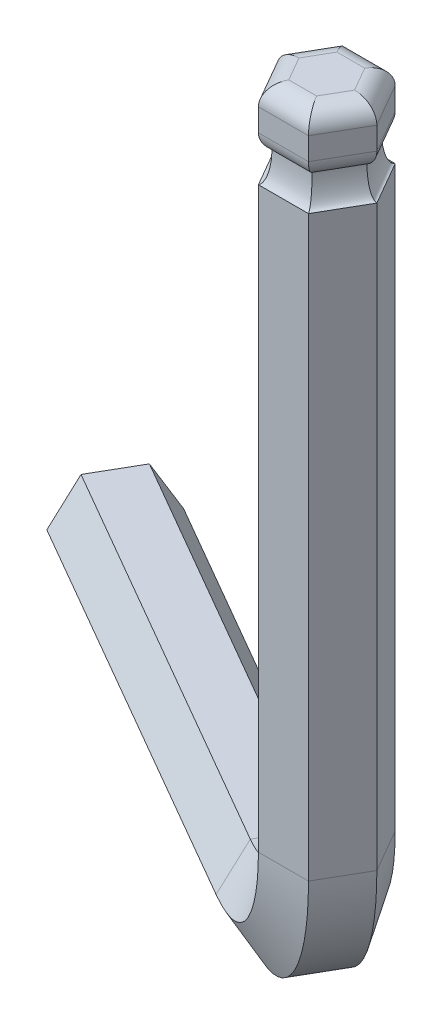
from build123d import *

# Parameters (mm, degrees)
BOSS_EXTRUDE1_DEPTH = 5
BOSS_EXTRUDE2_DEPTH = 10
BOSS_EXTRUDE3_DEPTH = 100
REVOLVE1_ANGLE      = 90
FILLET1_SIZE        = 1.5
FILLET1_SIZE_2      = 5
FILLET3_R           = 3.333333333
BOSS_EXTRUDE5_DEPTH = 80


with BuildPart() as part:
    # Sketch3 → Boss-Extrude1 (new body)
    with BuildSketch(Plane(origin=(0, 5, 0), x_dir=(1, 0, 0), z_dir=(0, 1, 0))):
        Polygon((6.92820323, 0), (3.464101615, 6), (-3.464101615, 6), (-6.92820323, 0), (-3.464101615, -6), (3.464101615, -6), align=None)
    extrude(amount=-BOSS_EXTRUDE1_DEPTH)

    # Sketch3<4> → Boss-Extrude2 (add)
    with BuildSketch(Plane(origin=(0, 5, 0), x_dir=(1, 0, 0), z_dir=(0, 1, 0))):
        Polygon((-4.330127019, -7.5), (4.330127019, -7.5), (8.660254038, 0), (4.330127019, 7.5), (-4.330127019, 7.5), (-8.660254038, 0), align=None)
    extrude(amount=BOSS_EXTRUDE2_DEPTH)

    # Sketch2 → Boss-Extrude3 (add)
    with BuildSketch(Plane(origin=(0, 0, 0), x_dir=(1, 0, 0), z_dir=(0, 1, 0))):
        Polygon((8.660254038, 0), (4.330127019, 7.5), (-4.330127019, 7.5), (-8.660254038, 0), (-4.330127019, -7.5), (4.330127019, -7.5), align=None)
    extrude(amount=-BOSS_EXTRUDE3_DEPTH)

    # Sketch11 → Revolve1 (revolve)
    with BuildSketch(Plane.XZ.offset(100)):
        Polygon((4.330127019, 7.5), (-4.330127019, 7.5), (-8.660254038, 0), (-4.330127019, -7.5), (4.330127019, -7.5), (8.660254038, 0), align=None)
    revolve(axis=Axis((-17.320508076, -100, -10), (0.5000000000000002, 0, -0.8660254037844386)), revolution_arc=REVOLVE1_ANGLE)

    # Fillet1
    # an asymmetric fillet: 5, 1.5 mm, written as the material it adds along each edge
    with BuildSketch(Plane(origin=(13.17820323, 0, 10.825317547), x_dir=(0.8660254037844384, 0, -0.5000000000000004), z_dir=(-0.5000000000000004, 0, -0.8660254037844384))) as fillet1_piece_1_section:
        with BuildLine():
            Bezier((FILLET1_SIZE, 0), (0, 0), (0, -FILLET1_SIZE_2), weights=[1, 0.707106781, 1])
            Line((0, -FILLET1_SIZE_2), (0, 0))
            Line((0, 0), (FILLET1_SIZE, 0))
        make_face()
    fillet1_piece_1 = extrude(amount=31.92820323, mode=Mode.PRIVATE)
    fillet1_piece_1 = split(fillet1_piece_1, bisect_by=Plane(origin=(7.905404029, 1.381969361, -1.692561432), z_dir=(-0.8660254037844389, 0, -0.49999999999999956)), keep=Keep.TOP, mode=Mode.PRIVATE)
    fillet1_piece_1 = split(fillet1_piece_1, bisect_by=Plane(origin=(5.41850775, 1.381969361, -6), z_dir=(0, 0, 1)), keep=Keep.TOP, mode=Mode.PRIVATE)
    add(fillet1_piece_1)
    with BuildSketch(Plane(origin=(-2.785898385, 0, 16.825317547), x_dir=(0.8660254037844388, 0, 0.49999999999999956), z_dir=(0.49999999999999956, 0, -0.8660254037844389))) as fillet1_piece_2_section:
        with BuildLine():
            Bezier((FILLET1_SIZE, 0), (0, 0), (0, -FILLET1_SIZE_2), weights=[1, 0.707106781, 1])
            Line((0, -FILLET1_SIZE_2), (0, 0))
            Line((0, 0), (FILLET1_SIZE, 0))
        make_face()
    fillet1_piece_2 = extrude(amount=31.92820323, mode=Mode.PRIVATE)
    fillet1_piece_2 = split(fillet1_piece_2, bisect_by=Plane(origin=(7.905406298, 1.381969361, 1.692565362), z_dir=(-0.8660254037844384, 0, 0.5000000000000004)), keep=Keep.TOP, mode=Mode.PRIVATE)
    fillet1_piece_2 = split(fillet1_piece_2, bisect_by=Plane(origin=(5.418503212, 1.381969361, 6), z_dir=(0, 0, -1)), keep=Keep.TOP, mode=Mode.PRIVATE)
    add(fillet1_piece_2)
    with BuildSketch(Plane(origin=(-15.964101615, 0, 6), x_dir=(0, 0, 1), z_dir=(1, 0, 0))) as fillet1_piece_3_section:
        with BuildLine():
            Bezier((FILLET1_SIZE, 0), (0, 0), (0, -FILLET1_SIZE_2), weights=[1, 0.707106781, 1])
            Line((0, -FILLET1_SIZE_2), (0, 0))
            Line((0, 0), (FILLET1_SIZE, 0))
        make_face()
    fillet1_piece_3 = extrude(amount=31.92820323, mode=Mode.PRIVATE)
    fillet1_piece_3 = split(fillet1_piece_3, bisect_by=Plane(origin=(-2.486900817, 1.381969361, 7.692561432), z_dir=(0.8660254037844386, 0, -0.5000000000000002)), keep=Keep.TOP, mode=Mode.PRIVATE)
    fillet1_piece_3 = split(fillet1_piece_3, bisect_by=Plane(origin=(2.486898548, 1.381969361, 7.692565362), z_dir=(-0.8660254037844389, 0, -0.49999999999999956)), keep=Keep.TOP, mode=Mode.PRIVATE)
    add(fillet1_piece_3)
    with BuildSketch(Plane(origin=(-13.17820323, 0, -10.825317547), x_dir=(-0.8660254037844385, 0, 0.5000000000000002), z_dir=(0.5000000000000002, 0, 0.8660254037844386))) as fillet1_piece_4_section:
        with BuildLine():
            Bezier((FILLET1_SIZE, 0), (0, 0), (0, -FILLET1_SIZE_2), weights=[1, 0.707106781, 1])
            Line((0, -FILLET1_SIZE_2), (0, 0))
            Line((0, 0), (FILLET1_SIZE, 0))
        make_face()
    fillet1_piece_4 = extrude(amount=31.92820323, mode=Mode.PRIVATE)
    fillet1_piece_4 = split(fillet1_piece_4, bisect_by=Plane(origin=(-7.905404029, 1.381969361, 1.692561432), z_dir=(0.8660254037844389, 0, 0.4999999999999997)), keep=Keep.TOP, mode=Mode.PRIVATE)
    fillet1_piece_4 = split(fillet1_piece_4, bisect_by=Plane(origin=(-5.41850775, 1.381969361, 6), z_dir=(0, 0, -1)), keep=Keep.TOP, mode=Mode.PRIVATE)
    add(fillet1_piece_4)
    with BuildSketch(Plane(origin=(2.785898385, 0, -16.825317547), x_dir=(-0.8660254037844388, 0, -0.4999999999999997), z_dir=(-0.4999999999999997, 0, 0.8660254037844389))) as fillet1_piece_5_section:
        with BuildLine():
            Bezier((FILLET1_SIZE, 0), (0, 0), (0, -FILLET1_SIZE_2), weights=[1, 0.707106781, 1])
            Line((0, -FILLET1_SIZE_2), (0, 0))
            Line((0, 0), (FILLET1_SIZE, 0))
        make_face()
    fillet1_piece_5 = extrude(amount=31.92820323, mode=Mode.PRIVATE)
    fillet1_piece_5 = split(fillet1_piece_5, bisect_by=Plane(origin=(-5.418503212, 1.381969361, -6), z_dir=(0, 0, 1)), keep=Keep.TOP, mode=Mode.PRIVATE)
    fillet1_piece_5 = split(fillet1_piece_5, bisect_by=Plane(origin=(-7.905406298, 1.381969361, -1.692565362), z_dir=(0.8660254037844386, 0, -0.5000000000000002)), keep=Keep.TOP, mode=Mode.PRIVATE)
    add(fillet1_piece_5)
    with BuildSketch(Plane(origin=(15.964101615, 0, -6), x_dir=(0, 0, -1), z_dir=(-1, 0, 0))) as fillet1_piece_6_section:
        with BuildLine():
            Bezier((FILLET1_SIZE, 0), (0, 0), (0, -FILLET1_SIZE_2), weights=[1, 0.707106781, 1])
            Line((0, -FILLET1_SIZE_2), (0, 0))
            Line((0, 0), (FILLET1_SIZE, 0))
        make_face()
    fillet1_piece_6 = extrude(amount=31.92820323, mode=Mode.PRIVATE)
    fillet1_piece_6 = split(fillet1_piece_6, bisect_by=Plane(origin=(2.486900817, 1.381969361, -7.692561432), z_dir=(-0.8660254037844384, 0, 0.5000000000000004)), keep=Keep.TOP, mode=Mode.PRIVATE)
    fillet1_piece_6 = split(fillet1_piece_6, bisect_by=Plane(origin=(-2.486898548, 1.381969361, -7.692565362), z_dir=(0.8660254037844389, 0, 0.4999999999999997)), keep=Keep.TOP, mode=Mode.PRIVATE)
    add(fillet1_piece_6)
    with BuildSketch(Plane(origin=(13.17820323, 0, 10.825317547), x_dir=(0.8660254037844384, 0, -0.5000000000000004), z_dir=(-0.5000000000000004, 0, -0.8660254037844384))) as fillet1_piece_7a_section:
        with BuildLine():
            Bezier((FILLET1_SIZE, 0), (0, 0), (0, -FILLET1_SIZE_2), weights=[1, 0.707106781, 1])
            Line((0, -FILLET1_SIZE_2), (0, 0))
            Line((0, 0), (FILLET1_SIZE, 0))
        make_face()
    fillet1_piece_7a = extrude(amount=31.92820323, mode=Mode.PRIVATE)
    fillet1_piece_7a = split(fillet1_piece_7a, bisect_by=Plane(origin=(8.170054225, 1.339304541, 0.849050982), z_dir=(-0.8660254037844386, 0, -0.5000000000000001)), keep=Keep.TOP, mode=Mode.PRIVATE)
    fillet1_piece_7a = split(fillet1_piece_7a, bisect_by=Plane(origin=(6.871016119, 1.339304541, 0.099050982), z_dir=(0.8660254037844389, 0, 0.49999999999999956)), keep=Keep.TOP, mode=Mode.PRIVATE)
    with BuildSketch(Plane(origin=(-2.785898385, 0, 16.825317547), x_dir=(0.8660254037844388, 0, 0.49999999999999956), z_dir=(0.49999999999999956, 0, -0.8660254037844389))) as fillet1_piece_7b_section:
        with BuildLine():
            Bezier((FILLET1_SIZE, 0), (0, 0), (0, -FILLET1_SIZE_2), weights=[1, 0.707106781, 1])
            Line((0, -FILLET1_SIZE_2), (0, 0))
            Line((0, 0), (FILLET1_SIZE, 0))
        make_face()
    fillet1_piece_7b = extrude(amount=31.92820323, mode=Mode.PRIVATE)
    fillet1_piece_7b = split(fillet1_piece_7b, bisect_by=Plane(origin=(8.17005329, 1.339302625, -0.849052601), z_dir=(-0.8660254037844385, 0, 0.5000000000000003)), keep=Keep.TOP, mode=Mode.PRIVATE)
    fillet1_piece_7b = split(fillet1_piece_7b, bisect_by=Plane(origin=(6.871015184, 1.339302625, -0.099052601), z_dir=(0.8660254037844384, 0, -0.5000000000000004)), keep=Keep.TOP, mode=Mode.PRIVATE)
    fillet1_piece_7 = fillet1_piece_7a & fillet1_piece_7b
    add(fillet1_piece_7)
    with BuildSketch(Plane(origin=(13.17820323, 0, 10.825317547), x_dir=(0.8660254037844384, 0, -0.5000000000000004), z_dir=(-0.5000000000000004, 0, -0.8660254037844384))) as fillet1_piece_8a_section:
        with BuildLine():
            Bezier((FILLET1_SIZE, 0), (0, 0), (0, -FILLET1_SIZE_2), weights=[1, 0.707106781, 1])
            Line((0, -FILLET1_SIZE_2), (0, 0))
            Line((0, 0), (FILLET1_SIZE, 0))
        make_face()
    fillet1_piece_8a = extrude(amount=31.92820323, mode=Mode.PRIVATE)
    fillet1_piece_8a = split(fillet1_piece_8a, bisect_by=Plane(origin=(3.349725523, 1.339302625, -7.5), z_dir=(0, 0, 1)), keep=Keep.TOP, mode=Mode.PRIVATE)
    fillet1_piece_8a = split(fillet1_piece_8a, bisect_by=Plane(origin=(3.349725523, 1.339302625, -6), z_dir=(0, 0, -1)), keep=Keep.TOP, mode=Mode.PRIVATE)
    with BuildSketch(Plane(origin=(15.964101615, 0, -6), x_dir=(0, 0, -1), z_dir=(-1, 0, 0))) as fillet1_piece_8b_section:
        with BuildLine():
            Bezier((FILLET1_SIZE, 0), (0, 0), (0, -FILLET1_SIZE_2), weights=[1, 0.707106781, 1])
            Line((0, -FILLET1_SIZE_2), (0, 0))
            Line((0, 0), (FILLET1_SIZE, 0))
        make_face()
    fillet1_piece_8b = extrude(amount=31.92820323, mode=Mode.PRIVATE)
    fillet1_piece_8b = split(fillet1_piece_8b, bisect_by=Plane(origin=(4.820326832, 1.339304541, -6.650949018), z_dir=(-0.8660254037844385, 0, 0.5000000000000003)), keep=Keep.TOP, mode=Mode.PRIVATE)
    fillet1_piece_8b = split(fillet1_piece_8b, bisect_by=Plane(origin=(3.521288727, 1.339304541, -5.900949018), z_dir=(0.8660254037844384, 0, -0.5000000000000004)), keep=Keep.TOP, mode=Mode.PRIVATE)
    fillet1_piece_8 = fillet1_piece_8a & fillet1_piece_8b
    add(fillet1_piece_8)
    with BuildSketch(Plane(origin=(-15.964101615, 0, 6), x_dir=(0, 0, 1), z_dir=(1, 0, 0))) as fillet1_piece_9a_section:
        with BuildLine():
            Bezier((FILLET1_SIZE, 0), (0, 0), (0, -FILLET1_SIZE_2), weights=[1, 0.707106781, 1])
            Line((0, -FILLET1_SIZE_2), (0, 0))
            Line((0, 0), (FILLET1_SIZE, 0))
        make_face()
    fillet1_piece_9a = extrude(amount=31.92820323, mode=Mode.PRIVATE)
    fillet1_piece_9a = split(fillet1_piece_9a, bisect_by=Plane(origin=(4.820327767, 1.339302625, 6.650947399), z_dir=(-0.8660254037844386, 0, -0.5000000000000001)), keep=Keep.TOP, mode=Mode.PRIVATE)
    fillet1_piece_9a = split(fillet1_piece_9a, bisect_by=Plane(origin=(3.521289661, 1.339302625, 5.900947399), z_dir=(0.8660254037844389, 0, 0.49999999999999956)), keep=Keep.TOP, mode=Mode.PRIVATE)
    with BuildSketch(Plane(origin=(-2.785898385, 0, 16.825317547), x_dir=(0.8660254037844388, 0, 0.49999999999999956), z_dir=(0.49999999999999956, 0, -0.8660254037844389))) as fillet1_piece_9b_section:
        with BuildLine():
            Bezier((FILLET1_SIZE, 0), (0, 0), (0, -FILLET1_SIZE_2), weights=[1, 0.707106781, 1])
            Line((0, -FILLET1_SIZE_2), (0, 0))
            Line((0, 0), (FILLET1_SIZE, 0))
        make_face()
    fillet1_piece_9b = extrude(amount=31.92820323, mode=Mode.PRIVATE)
    fillet1_piece_9b = split(fillet1_piece_9b, bisect_by=Plane(origin=(3.349727392, 1.339304541, 7.5), z_dir=(0, 0, -1)), keep=Keep.TOP, mode=Mode.PRIVATE)
    fillet1_piece_9b = split(fillet1_piece_9b, bisect_by=Plane(origin=(3.349727392, 1.339304541, 6), z_dir=(0, 0, 1)), keep=Keep.TOP, mode=Mode.PRIVATE)
    fillet1_piece_9 = fillet1_piece_9a & fillet1_piece_9b
    add(fillet1_piece_9)
    with BuildSketch(Plane(origin=(-13.17820323, 0, -10.825317547), x_dir=(-0.8660254037844385, 0, 0.5000000000000002), z_dir=(0.5000000000000002, 0, 0.8660254037844386))) as fillet1_piece_10a_section:
        with BuildLine():
            Bezier((FILLET1_SIZE, 0), (0, 0), (0, -FILLET1_SIZE_2), weights=[1, 0.707106781, 1])
            Line((0, -FILLET1_SIZE_2), (0, 0))
            Line((0, 0), (FILLET1_SIZE, 0))
        make_face()
    fillet1_piece_10a = extrude(amount=31.92820323, mode=Mode.PRIVATE)
    fillet1_piece_10a = split(fillet1_piece_10a, bisect_by=Plane(origin=(-3.349725523, 1.339302625, 7.5), z_dir=(0, 0, -1)), keep=Keep.TOP, mode=Mode.PRIVATE)
    fillet1_piece_10a = split(fillet1_piece_10a, bisect_by=Plane(origin=(-3.349725523, 1.339302625, 6), z_dir=(0, 0, 1)), keep=Keep.TOP, mode=Mode.PRIVATE)
    with BuildSketch(Plane(origin=(-15.964101615, 0, 6), x_dir=(0, 0, 1), z_dir=(1, 0, 0))) as fillet1_piece_10b_section:
        with BuildLine():
            Bezier((FILLET1_SIZE, 0), (0, 0), (0, -FILLET1_SIZE_2), weights=[1, 0.707106781, 1])
            Line((0, -FILLET1_SIZE_2), (0, 0))
            Line((0, 0), (FILLET1_SIZE, 0))
        make_face()
    fillet1_piece_10b = extrude(amount=31.92820323, mode=Mode.PRIVATE)
    fillet1_piece_10b = split(fillet1_piece_10b, bisect_by=Plane(origin=(-4.820326832, 1.339304541, 6.650949018), z_dir=(0.8660254037844387, 0, -0.5000000000000001)), keep=Keep.TOP, mode=Mode.PRIVATE)
    fillet1_piece_10b = split(fillet1_piece_10b, bisect_by=Plane(origin=(-3.521288727, 1.339304541, 5.900949018), z_dir=(-0.8660254037844386, 0, 0.5000000000000002)), keep=Keep.TOP, mode=Mode.PRIVATE)
    fillet1_piece_10 = fillet1_piece_10a & fillet1_piece_10b
    add(fillet1_piece_10)
    with BuildSketch(Plane(origin=(2.785898385, 0, -16.825317547), x_dir=(-0.8660254037844388, 0, -0.4999999999999997), z_dir=(-0.4999999999999997, 0, 0.8660254037844389))) as fillet1_piece_11a_section:
        with BuildLine():
            Bezier((FILLET1_SIZE, 0), (0, 0), (0, -FILLET1_SIZE_2), weights=[1, 0.707106781, 1])
            Line((0, -FILLET1_SIZE_2), (0, 0))
            Line((0, 0), (FILLET1_SIZE, 0))
        make_face()
    fillet1_piece_11a = extrude(amount=31.92820323, mode=Mode.PRIVATE)
    fillet1_piece_11a = split(fillet1_piece_11a, bisect_by=Plane(origin=(-8.17005329, 1.339302625, 0.849052601), z_dir=(0.8660254037844387, 0, -0.5000000000000001)), keep=Keep.TOP, mode=Mode.PRIVATE)
    fillet1_piece_11a = split(fillet1_piece_11a, bisect_by=Plane(origin=(-6.871015184, 1.339302625, 0.099052601), z_dir=(-0.8660254037844386, 0, 0.5000000000000002)), keep=Keep.TOP, mode=Mode.PRIVATE)
    with BuildSketch(Plane(origin=(-13.17820323, 0, -10.825317547), x_dir=(-0.8660254037844385, 0, 0.5000000000000002), z_dir=(0.5000000000000002, 0, 0.8660254037844386))) as fillet1_piece_11b_section:
        with BuildLine():
            Bezier((FILLET1_SIZE, 0), (0, 0), (0, -FILLET1_SIZE_2), weights=[1, 0.707106781, 1])
            Line((0, -FILLET1_SIZE_2), (0, 0))
            Line((0, 0), (FILLET1_SIZE, 0))
        make_face()
    fillet1_piece_11b = extrude(amount=31.92820323, mode=Mode.PRIVATE)
    fillet1_piece_11b = split(fillet1_piece_11b, bisect_by=Plane(origin=(-8.170054225, 1.339304541, -0.849050982), z_dir=(0.8660254037844387, 0, 0.5000000000000001)), keep=Keep.TOP, mode=Mode.PRIVATE)
    fillet1_piece_11b = split(fillet1_piece_11b, bisect_by=Plane(origin=(-6.871016119, 1.339304541, -0.099050982), z_dir=(-0.8660254037844389, 0, -0.4999999999999997)), keep=Keep.TOP, mode=Mode.PRIVATE)
    fillet1_piece_11 = fillet1_piece_11a & fillet1_piece_11b
    add(fillet1_piece_11)
    with BuildSketch(Plane(origin=(15.964101615, 0, -6), x_dir=(0, 0, -1), z_dir=(-1, 0, 0))) as fillet1_piece_12a_section:
        with BuildLine():
            Bezier((FILLET1_SIZE, 0), (0, 0), (0, -FILLET1_SIZE_2), weights=[1, 0.707106781, 1])
            Line((0, -FILLET1_SIZE_2), (0, 0))
            Line((0, 0), (FILLET1_SIZE, 0))
        make_face()
    fillet1_piece_12a = extrude(amount=31.92820323, mode=Mode.PRIVATE)
    fillet1_piece_12a = split(fillet1_piece_12a, bisect_by=Plane(origin=(-4.820327767, 1.339302625, -6.650947399), z_dir=(0.8660254037844387, 0, 0.5000000000000001)), keep=Keep.TOP, mode=Mode.PRIVATE)
    fillet1_piece_12a = split(fillet1_piece_12a, bisect_by=Plane(origin=(-3.521289661, 1.339302625, -5.900947399), z_dir=(-0.8660254037844389, 0, -0.4999999999999997)), keep=Keep.TOP, mode=Mode.PRIVATE)
    with BuildSketch(Plane(origin=(2.785898385, 0, -16.825317547), x_dir=(-0.8660254037844388, 0, -0.4999999999999997), z_dir=(-0.4999999999999997, 0, 0.8660254037844389))) as fillet1_piece_12b_section:
        with BuildLine():
            Bezier((FILLET1_SIZE, 0), (0, 0), (0, -FILLET1_SIZE_2), weights=[1, 0.707106781, 1])
            Line((0, -FILLET1_SIZE_2), (0, 0))
            Line((0, 0), (FILLET1_SIZE, 0))
        make_face()
    fillet1_piece_12b = extrude(amount=31.92820323, mode=Mode.PRIVATE)
    fillet1_piece_12b = split(fillet1_piece_12b, bisect_by=Plane(origin=(-3.349727392, 1.339304541, -7.5), z_dir=(0, 0, 1)), keep=Keep.TOP, mode=Mode.PRIVATE)
    fillet1_piece_12b = split(fillet1_piece_12b, bisect_by=Plane(origin=(-3.349727392, 1.339304541, -6), z_dir=(0, 0, -1)), keep=Keep.TOP, mode=Mode.PRIVATE)
    fillet1_piece_12 = fillet1_piece_12a & fillet1_piece_12b
    add(fillet1_piece_12)

    # Fillet3
    # the kernel refuses this fillet: 3.333333333 mm, written as the material it takes off along each edge
    with BuildSketch(Plane(origin=(-0.850274292, 5, -13.527281726), x_dir=(0.8660254037844387, 1.5324038334544087e-12, 0.5000000000000001), z_dir=(-0.5000000000000001, 0, 0.8660254037844387)), Plane(origin=(11.289832472, 5, -7.5), x_dir=(0, 1.5335880713473393e-12, 1.0), z_dir=(-1, 0, 0)), Plane(origin=(12.140106765, 5, 6.027281726), x_dir=(-0.8660254037844384, 1.533588071347337e-12, 0.5000000000000003), z_dir=(-0.5000000000000003, 0, -0.8660254037844385)), Plane(origin=(0.850274292, 5, 13.527281726), x_dir=(-0.8660254037844387, 1.5324038334544105e-12, -0.5000000000000001), z_dir=(0.5000000000000001, 0, -0.8660254037844386)), Plane(origin=(-11.289832472, 5, 7.5), x_dir=(0, 1.5335880713473356e-12, -1.0), z_dir=(1, 0, 0)), Plane(origin=(-12.140106765, 5, -6.027281726), x_dir=(0.8660254037844387, 1.5335880713473358e-12, -0.5000000000000001), z_dir=(0.5000000000000001, 0, 0.8660254037844387))) as fillet3_piece_1:
        with BuildLine():
            CenterArc((3.333333333, 2.783882181), FILLET3_R, 180, 56.632987031)
            Line((0, 2.783882181), (-0.066666667, 2.783882181))
            Line((-0.066666667, 2.783882181), (-0.066666667, 0))
            Line((-0.066666667, 0), (0, -0.066666667))
            ThreePointArc((0, -0.066666667), (0.75, -0.066666667), (1.463333333, -0.055677644))
            Line((1.463333333, -0.055677644), (1.5, 0))
        make_face()
    extrude(amount=22.579664945, mode=Mode.SUBTRACT)
    with BuildSketch(Plane(origin=(-12.826920705, 15, -7.216878365), x_dir=(0, -1, 0), z_dir=(0.5000000000000001, 0, 0.8660254037844387)), Plane(origin=(-0.163460352, 15, -14.716878365), x_dir=(0, -1, 0), z_dir=(-0.5000000000000001, 0, 0.8660254037844387)), Plane(origin=(12.663460352, 15, -7.5), x_dir=(0, -1, 0), z_dir=(-1, 0, 0)), Plane(origin=(0.163460352, 15, 14.716878365), x_dir=(0, -1, 0), z_dir=(0.5000000000000001, 0, -0.8660254037844386)), Plane(origin=(12.826920705, 15, 7.216878365), x_dir=(0, -1, 0), z_dir=(-0.5000000000000003, 0, -0.8660254037844385)), Plane(origin=(-12.663460352, 15, 7.5), x_dir=(0, -1, 0), z_dir=(1, 0, 0))) as fillet3_piece_2:
        with BuildLine():
            CenterArc((FILLET3_R, FILLET3_R), FILLET3_R, 180, 90)
            Line((0, FILLET3_R), (-FILLET3_R * 0.020000000002, FILLET3_R))
            Line((-FILLET3_R * 0.020000000002, FILLET3_R), (-FILLET3_R * 0.020000000002, -FILLET3_R * 0.020000000002))
            Line((-FILLET3_R * 0.020000000002, -FILLET3_R * 0.020000000002), (FILLET3_R, -FILLET3_R * 0.020000000002))
            Line((FILLET3_R, -FILLET3_R * 0.020000000002), (FILLET3_R, 0))
        make_face()
    extrude(amount=25.326920705, mode=Mode.SUBTRACT)

    # Sketch13 → Boss-Extrude5 (add)
    with BuildSketch(Plane(origin=(-17.320508076, 0, -10), x_dir=(-0.5000000000000001, 2.0158076908516384e-15, 0.8660254037844386), z_dir=(-0.8660254037844386, 3.491481338843133e-15, -0.5000000000000001))):
        Polygon((4.330127019, -127.5), (8.660254038, -120), (4.330127019, -112.5), (-4.330127019, -112.5), (-8.660254038, -120), (-4.330127019, -127.5), align=None)
    extrude(amount=BOSS_EXTRUDE5_DEPTH)


solid = part.part
